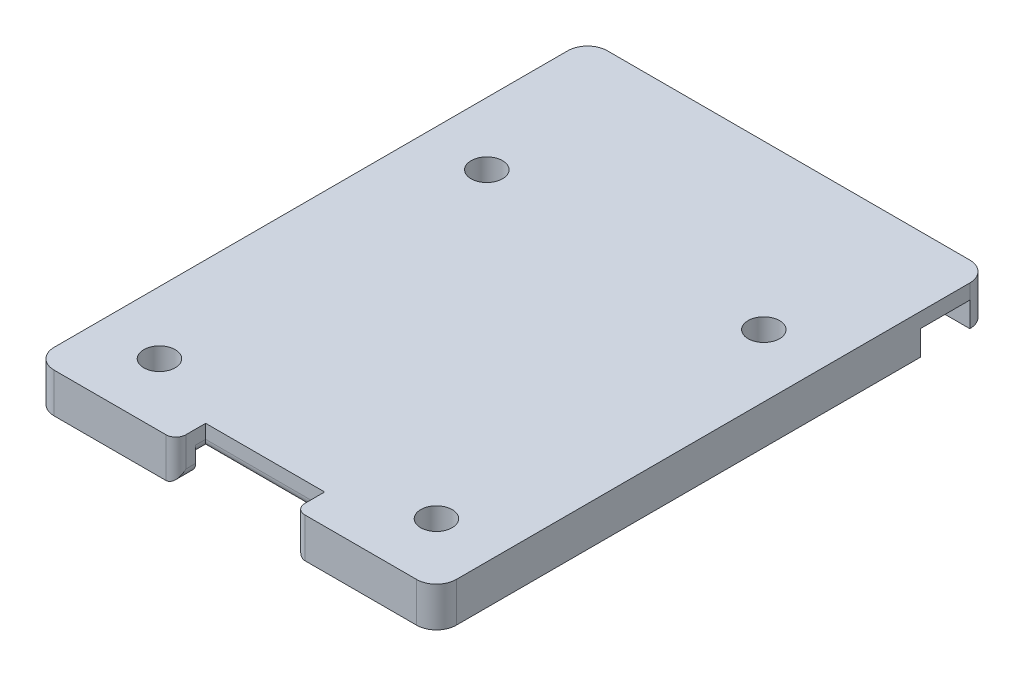
from build123d import *

# Parameters (mm, degrees)
SKETCH1_R           = 1.5875000000000004
SKETCH1_R_2         = 1.5874999999999988
SKETCH1_R_3         = 1.5874999999999977
SKETCH1_R_4         = 1.5874999999999986
BOSS_EXTRUDE2_DEPTH = 4
CUT_EXTRUDE1_DEPTH  = 1.6
CUT_EXTRUDE2_DEPTH  = 1.6002
SKETCH4_W           = 2
SKETCH4_H           = 5
SKETCH4_W_2         = 2.000000000000001
CUT_EXTRUDE3_DEPTH  = 2.5
CUT_EXTRUDE4_DEPTH  = 3
FILLET1_R           = 2
FILLET2_R           = 1


with BuildPart() as part:
    # Sketch1 → Boss-Extrude2 (new body)
    with BuildSketch(Plane(origin=(0, 0, 0), x_dir=(1, 0, 0), z_dir=(0, 1, 0))):
        Polygon((-9.817707317102446, 23.463272745610922), (30.74229268289756, 23.463272745610926), (30.742292682897567, -32.336727254389075), (-9.81770731710244, -32.336727254389075), align=None)
        with Locations(Location((-3.5077073171024433, 6.993272745610932, 0), (0, 0, 270))):
            Circle(SKETCH1_R, mode=Mode.SUBTRACT)
        with Locations(Location((24.432292682897558, 6.993272745610931, 0), (0, 0, 270))):
            Circle(SKETCH1_R_2, mode=Mode.SUBTRACT)
        with Locations(Location((-3.5077073171024393, -26.026727254389073, 0), (0, 0, 270))):
            Circle(SKETCH1_R_3, mode=Mode.SUBTRACT)
        with Locations(Location((24.432292682897558, -26.026727254389073, 0), (0, 0, 270))):
            Circle(SKETCH1_R_4, mode=Mode.SUBTRACT)
    extrude(amount=BOSS_EXTRUDE2_DEPTH)

    # Sketch1<4> → Cut-Extrude1 (cut)
    with BuildSketch(Plane(origin=(0, 0, 0), x_dir=(1, 0, 0), z_dir=(0, 1, 0))):
        Polygon((-7.817707317102445, 21.463272745610922), (28.742292682897556, 21.463272745610926), (28.742292682897563, -30.336727254389075), (-7.817707317102438, -30.336727254389075), align=None)
    extrude(amount=CUT_EXTRUDE1_DEPTH, mode=Mode.SUBTRACT)

    # Sketch3 → Cut-Extrude2 (cut)
    with BuildSketch(Plane.XZ.offset(-1.6)):
        Polygon((-7.317707317102444, -15.463272745610924), (28.242292682897553, -15.463272745610924), (28.242292682897553, -19.463272745610922), (-7.317707317102443, -19.463272745610922), align=None)
        Polygon((2.182292682897542, 28.33672725438907), (18.74229268289756, 28.33672725438907), (18.74229268289756, 18.336727254389068), (2.1822926828975433, 18.336727254389068), align=None)
        Polygon((4.182292682897542, 16.336727254389075), (27.242292682897556, 16.336727254389075), (27.242292682897556, 2.3367272543890727), (4.182292682897544, 2.3367272543890727), align=None)
    extrude(amount=-CUT_EXTRUDE2_DEPTH, mode=Mode.SUBTRACT)

    # Sketch4 → Cut-Extrude3 (cut)
    with BuildSketch(Plane.XZ):
        with Locations((29.74229268289756, -18.96327274561092)):
            Rectangle(SKETCH4_W, SKETCH4_H)
        with Locations((-8.817707317102446, -18.96327274561092)):
            Rectangle(SKETCH4_W_2, SKETCH4_H)
    extrude(amount=-CUT_EXTRUDE3_DEPTH, mode=Mode.SUBTRACT)

    # Sketch5 → Cut-Extrude4 (cut)
    with BuildSketch(Plane(origin=(0, 0, 32.336727254389075), x_dir=(-1, 0, 0), z_dir=(0, 0, -1))):
        Polygon((-16.462292682897562, 4.000000000000003), (-4.462292682897565, 4.000000000000007), (-4.462292682897558, -5.590997478767573), (-16.462292682897562, -5.590997478767577), align=None)
    extrude(amount=CUT_EXTRUDE4_DEPTH, mode=Mode.SUBTRACT)

    # Fillet1
    fillet1_edges = [part.edges().sort_by_distance(p)[0] for p in [
        (-9.817707317102446, 2, -23.463272745610922),
        (30.74229268289756, 2, -23.463272745610926),
        (30.742292682897567, 2, 32.336727254389075),
        (-9.81770731710244, 2, 32.336727254389075),
    ]]
    fillet(fillet1_edges, radius=FILLET1_R)

    # Fillet2
    fillet2_edges = [part.edges().sort_by_distance(p)[0] for p in [
        (10.46229268289756, 1.6, 29.336727254389075),
        (4.462292682897564, 1.6, 29.836727254389075),
        (16.462292682897562, 1.6000000000000003, 29.836727254389075),
        (16.462292682897562, 2.000000000000001, 32.336727254389075),
        (4.462292682897563, 2.0000000000000036, 32.336727254389075),
        (16.462292682897562, 0, 31.336727254389075),
        (4.462292682897562, 0, 31.336727254389075),
    ]]
    fillet(fillet2_edges, radius=FILLET2_R - 0.0001)  # a hair under: the kernel refuses the full size


solid = part.part
